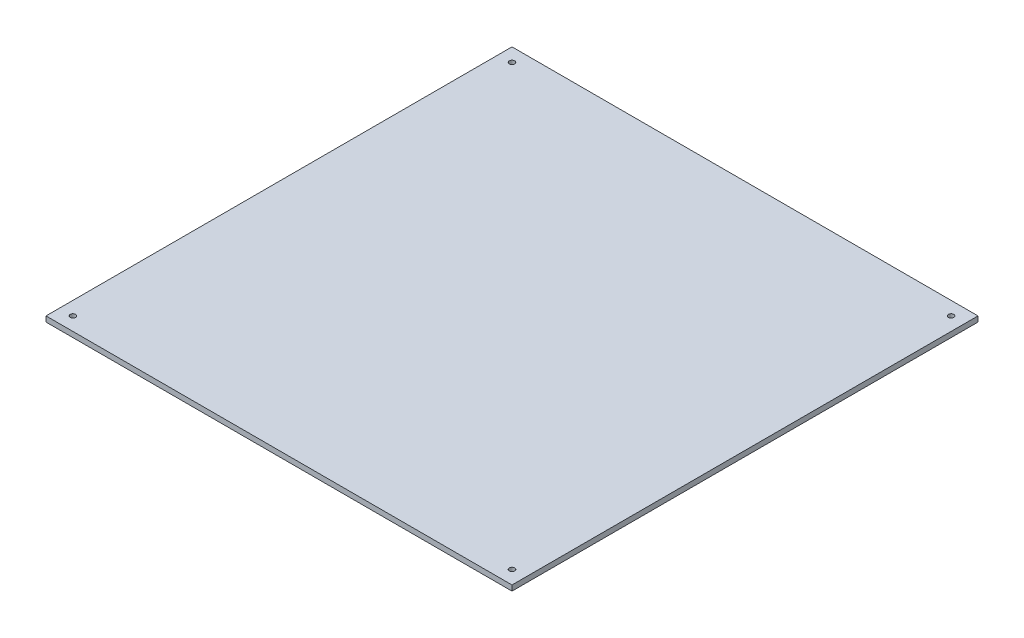
from build123d import *

# Parameters (mm, degrees)
ESBO_O1_W                = 260
ESBO_O1_H                = 260
ESBO_O1_R                = 1.5
RESSALTO_EXTRUS_O1_DEPTH = 3


with BuildPart() as part:
    # Esboço1 → Ressalto-extrusão1 (new body)
    with BuildSketch(Plane(origin=(0, 0, 0), x_dir=(1, 0, 0), z_dir=(0, 1, 0))):
        Rectangle(ESBO_O1_W, ESBO_O1_H)
        with Locations((-122.5, 122.5)):
            Circle(ESBO_O1_R, mode=Mode.SUBTRACT)
        with Locations((-122.5, -122.5)):
            Circle(ESBO_O1_R, mode=Mode.SUBTRACT)
        with Locations((122.5, -122.5)):
            Circle(ESBO_O1_R, mode=Mode.SUBTRACT)
        with Locations((122.5, 122.5)):
            Circle(ESBO_O1_R, mode=Mode.SUBTRACT)
    extrude(amount=RESSALTO_EXTRUS_O1_DEPTH)


solid = part.part
